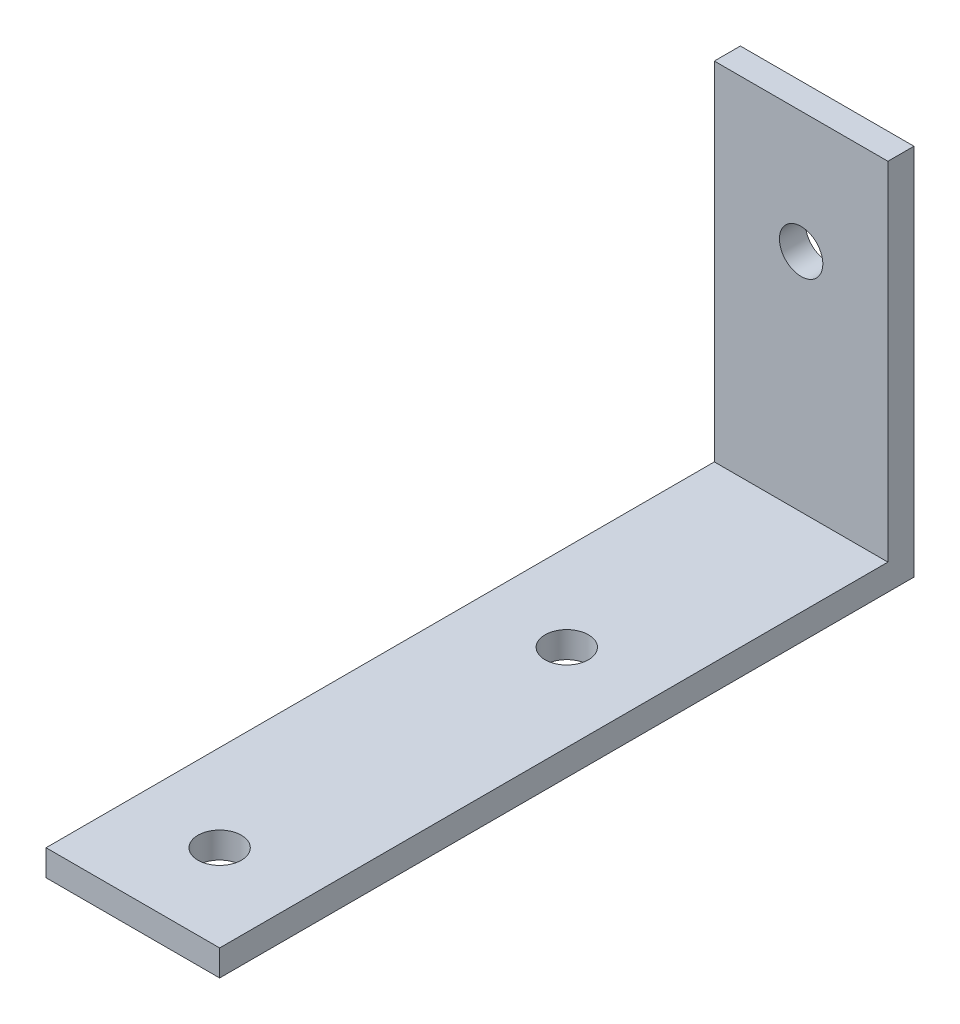
from build123d import *

# Parameters (mm, degrees)
SKETCH1_W           = 20
SKETCH1_H           = 80
SKETCH1_R           = 2.5
BOSS_EXTRUDE1_DEPTH = 3
SKETCH2_W           = 20
SKETCH2_H           = 3
BOSS_EXTRUDE2_DEPTH = 40
SKETCH3_R           = 2.5
CUT_EXTRUDE1_DEPTH  = 3


with BuildPart() as part:
    # Sketch1 → Boss-Extrude1 (new body)
    with BuildSketch(Plane(origin=(0, 0, 0), x_dir=(1, 0, 0), z_dir=(0, 1, 0))):
        Rectangle(SKETCH1_W, SKETCH1_H)
        with Locations((0, -30)):
            Circle(SKETCH1_R, mode=Mode.SUBTRACT)
        with Locations((0, 10)):
            Circle(SKETCH1_R, mode=Mode.SUBTRACT)
    extrude(amount=BOSS_EXTRUDE1_DEPTH)

    # Sketch2 → Boss-Extrude2 (add)
    with BuildSketch(Plane(origin=(0, 3, 0), x_dir=(1, 0, 0), z_dir=(0, 1, 0))):
        with Locations((0, 38.5)):
            Rectangle(SKETCH2_W, SKETCH2_H)
    extrude(amount=BOSS_EXTRUDE2_DEPTH)

    # Sketch3 → Cut-Extrude1 (cut)
    with BuildSketch(Plane(origin=(0, 0, -40), x_dir=(-1, 0, 0), z_dir=(0, 0, -1))):
        with Locations((0, 29)):
            Circle(SKETCH3_R)
    extrude(amount=-CUT_EXTRUDE1_DEPTH, mode=Mode.SUBTRACT)


solid = part.part
